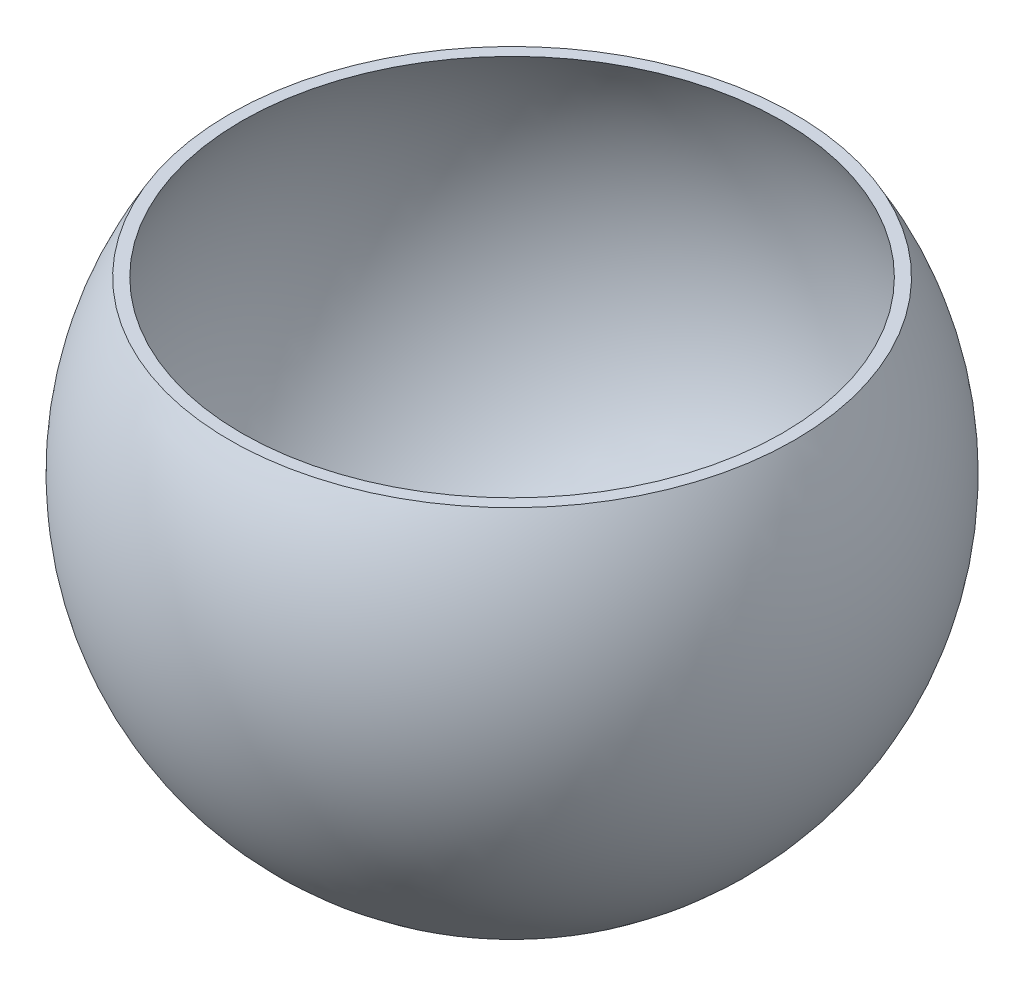
from build123d import *


with BuildPart() as part:
    # Sketch1 → Revolve1 (revolve)
    with BuildSketch(Plane.XY):
        with BuildLine():
            Line((174.101233777, 193.672409282), (166.646098372, 193.672409282))
            ThreePointArc((166.646098372, 193.672409282), (172.302072359, -6.302424889), (0, -107.958316033))
            Line((0, -107.958316033), (0, -114.308316033))
            ThreePointArc((0, -114.308316033), (176.892175327, -11.105307527), (174.101233777, 193.672409282))
        make_face()
    revolve(axis=Axis((0, 0, 0), (0, -1, 0)))


solid = part.part
